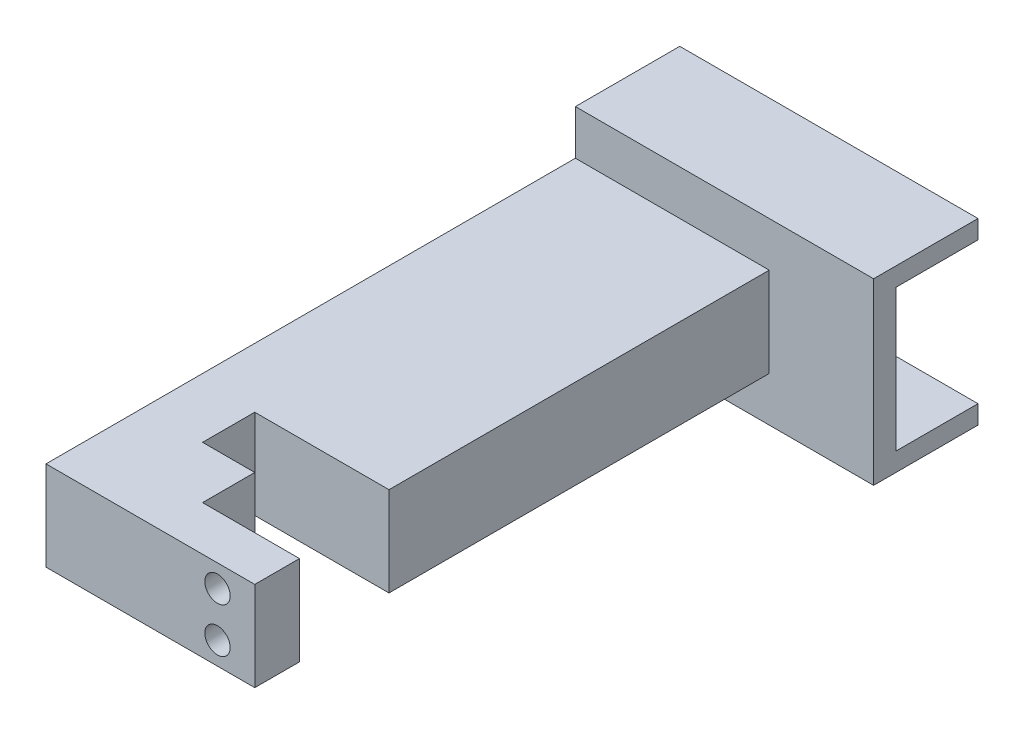
from build123d import *

# Parameters (mm, degrees)
OUTBOARD_FOOT_START                           = -6
SKETCH1_W                                     = 14
SKETCH1_H                                     = 12
SKETCH1_R                                     = 1.7
OUTBOARD_FOOT_DEPTH                           = 6
DROP_WEB_START                                = -71
SKETCH2_W                                     = 12
SKETCH2_H                                     = 12
DROP_WEB_DEPTH                                = 69.5
CROSS_SLOT_BLOCK_START                        = -85
SKETCH3_W                                     = 40
SKETCH3_H                                     = 24
CROSS_SLOT_BLOCK_DEPTH                        = 14
X_FLOATING_Y_DRIVEN_SLOT_DEPTH                = 108.763630228
X_FLOATING_Y_DRIVEN_SLOT_DEPTH_BACK           = 108.763630228
SKETCH4_W                                     = 8
SKETCH4_H                                     = 19.02
OUTBOARD_CLEARANCE_WEB_START                  = -71
SKETCH5_W                                     = 14
SKETCH5_H                                     = 12
OUTBOARD_CLEARANCE_WEB_DEPTH                  = 65
FIXED_BASE_EAR_CLEARANCE_CUT_DEPTH            = 108.763630228
FIXED_BASE_EAR_CLEARANCE_CUT_DEPTH_BACK       = 108.763630228
SKETCH6_W                                     = 19
SKETCH6_H                                     = 7
SLOT_BOTTOM_UPRISER_OPENING_DEPTH             = 108.763630228
SLOT_BOTTOM_UPRISER_OPENING_DEPTH_BACK        = 108.763630228
SKETCH7_W                                     = 11.5
SKETCH7_H                                     = 19.02
OUTBOARD_FOOT_WEB_BRIDGE_START                = -7
SKETCH8_W                                     = 15
SKETCH8_H                                     = 12
OUTBOARD_FOOT_WEB_BRIDGE_DEPTH                = 7
YDROP_M3_FASTENER_UNDERFOOT_RELIEF_DEPTH      = 108.763630228
YDROP_M3_FASTENER_UNDERFOOT_RELIEF_DEPTH_BACK = 108.763630228
SKETCH9_W                                     = 12
SKETCH9_H                                     = 7.5
YDROP_M3_THROUGH_RECUT_START                  = -6.5
SKETCH10_R                                    = 1.7
YDROP_M3_THROUGH_RECUT_DEPTH                  = 6.5


with BuildPart() as part:
    # Sketch1 → Outboard_Foot (new body)
    with BuildSketch(Plane.XY.offset(OUTBOARD_FOOT_START)):
        with Locations((-37, -20)):
            Rectangle(SKETCH1_W, SKETCH1_H)
        with Locations((-35, -23)):
            Circle(SKETCH1_R, mode=Mode.SUBTRACT)
        with Locations((-35, -17)):
            Circle(SKETCH1_R, mode=Mode.SUBTRACT)
    extrude(amount=OUTBOARD_FOOT_DEPTH)

    # Sketch2 → Drop_Web (add)
    with BuildSketch(Plane.XY.offset(DROP_WEB_START)):
        with Locations((-38, -20)):
            Rectangle(SKETCH2_W, SKETCH2_H)
    extrude(amount=DROP_WEB_DEPTH)

    # Sketch3 → Cross_Slot_Block (add)
    with BuildSketch(Plane.XY.offset(CROSS_SLOT_BLOCK_START)):
        with Locations((-38, -20)):
            Rectangle(SKETCH3_W, SKETCH3_H)
    extrude(amount=CROSS_SLOT_BLOCK_DEPTH)

    # Sketch4 → X_Floating_Y_Driven_Slot (cut, two sides: drawn at the far end of the back side and taken through both)
    with BuildSketch(Plane(origin=(0, 0, 0), x_dir=(0, 0, -1), z_dir=(1, 0, 0)).offset(-X_FLOATING_Y_DRIVEN_SLOT_DEPTH_BACK)):
        with Locations((78, -20)):
            Rectangle(SKETCH4_W, SKETCH4_H)
    extrude(amount=X_FLOATING_Y_DRIVEN_SLOT_DEPTH + X_FLOATING_Y_DRIVEN_SLOT_DEPTH_BACK, mode=Mode.SUBTRACT)

    # Sketch5 → Outboard_Clearance_Web (add)
    with BuildSketch(Plane.XY.offset(OUTBOARD_CLEARANCE_WEB_START)):
        with Locations((-51, -20)):
            Rectangle(SKETCH5_W, SKETCH5_H)
    extrude(amount=OUTBOARD_CLEARANCE_WEB_DEPTH)

    # Sketch6 → Fixed_Base_Ear_Clearance_Cut (cut, two sides: drawn at the far end of the back side and taken through both)
    with BuildSketch(Plane(origin=(0, 0, 0), x_dir=(1, 0, 0), z_dir=(0, 1, 0)).offset(-FIXED_BASE_EAR_CLEARANCE_CUT_DEPTH_BACK)):
        with Locations((-40.5, 16.5)):
            Rectangle(SKETCH6_W, SKETCH6_H)
    extrude(amount=FIXED_BASE_EAR_CLEARANCE_CUT_DEPTH + FIXED_BASE_EAR_CLEARANCE_CUT_DEPTH_BACK, mode=Mode.SUBTRACT)

    # Sketch7 → Slot_Bottom_Upriser_Opening (cut, two sides: drawn at the far end of the back side and taken through both)
    with BuildSketch(Plane(origin=(0, 0, 0), x_dir=(0, 0, -1), z_dir=(1, 0, 0)).offset(-SLOT_BOTTOM_UPRISER_OPENING_DEPTH_BACK)):
        with Locations((79.75, -20)):
            Rectangle(SKETCH7_W, SKETCH7_H)
    extrude(amount=SLOT_BOTTOM_UPRISER_OPENING_DEPTH + SLOT_BOTTOM_UPRISER_OPENING_DEPTH_BACK, mode=Mode.SUBTRACT)

    # Sketch8 → Outboard_Foot_Web_Bridge (add)
    with BuildSketch(Plane.XY.offset(OUTBOARD_FOOT_WEB_BRIDGE_START)):
        with Locations((-50.5, -20)):
            Rectangle(SKETCH8_W, SKETCH8_H)
    extrude(amount=OUTBOARD_FOOT_WEB_BRIDGE_DEPTH)

    # Sketch9 → YDrop_M3_Fastener_Underfoot_Relief (cut, two sides: drawn at the far end of the back side and taken through both)
    with BuildSketch(Plane(origin=(0, 0, 0), x_dir=(1, 0, 0), z_dir=(0, 1, 0)).offset(-YDROP_M3_FASTENER_UNDERFOOT_RELIEF_DEPTH_BACK)):
        with Locations((-37, 9.75)):
            Rectangle(SKETCH9_W, SKETCH9_H)
    extrude(amount=YDROP_M3_FASTENER_UNDERFOOT_RELIEF_DEPTH + YDROP_M3_FASTENER_UNDERFOOT_RELIEF_DEPTH_BACK, mode=Mode.SUBTRACT)

    # Sketch10 → YDrop_M3_Through_Recut (cut)
    with BuildSketch(Plane.XY.offset(YDROP_M3_THROUGH_RECUT_START)):
        with Locations((-35, -23)):
            Circle(SKETCH10_R)
        with Locations((-35, -17)):
            Circle(SKETCH10_R)
    extrude(amount=YDROP_M3_THROUGH_RECUT_DEPTH, mode=Mode.SUBTRACT)


solid = part.part
